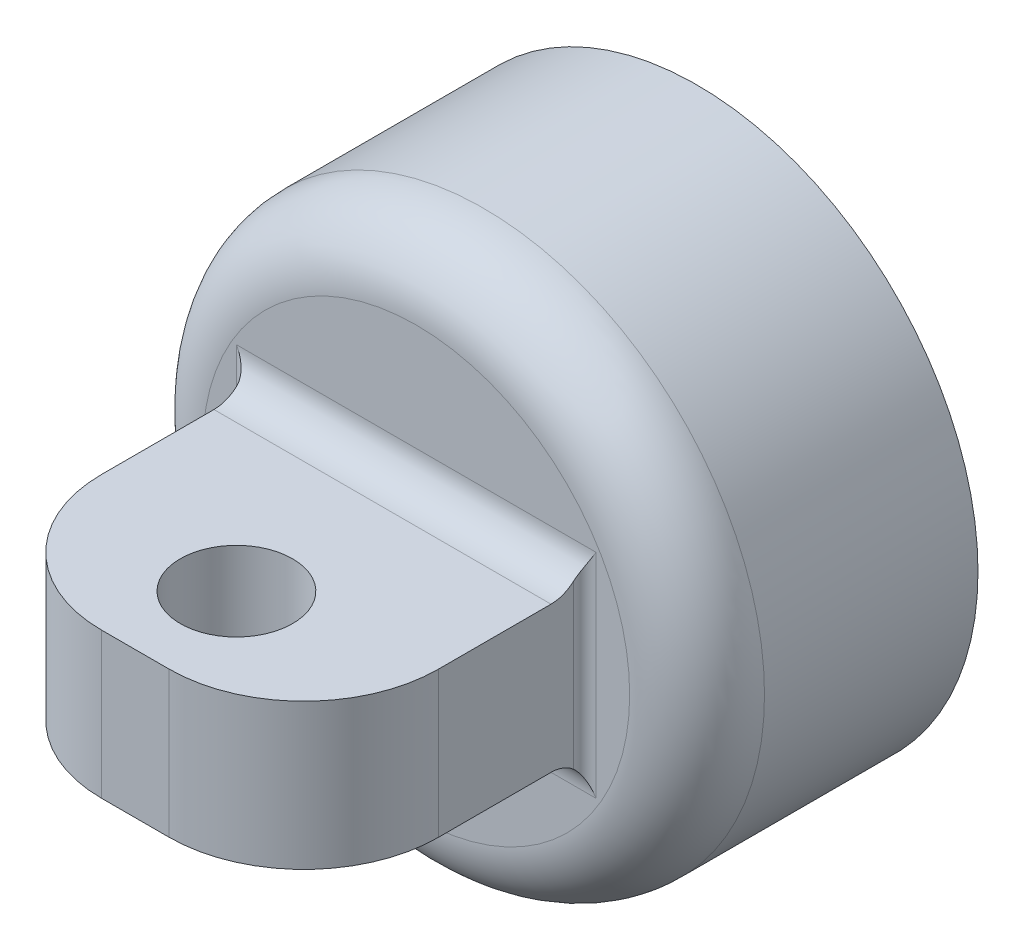
from build123d import *

# Parameters (mm, degrees)
SKETCH1_R           = 25
BOSS_EXTRUDE1_DEPTH = 25
SKETCH2_W           = 30
SKETCH2_H           = 12.964212382
BOSS_EXTRUDE2_DEPTH = 25
FILLET1_R           = 12
FILLET2_R           = 1
FILLET3_R           = 3
SKETCH3_R           = 5
CUT_EXTRUDE1_DEPTH  = 12.964212381
FILLET4_R           = 6


with BuildPart() as part:
    # Sketch1 → Boss-Extrude1 (new body)
    with BuildSketch(Plane.XY):
        Circle(SKETCH1_R)
    extrude(amount=BOSS_EXTRUDE1_DEPTH)

    # Sketch2 → Boss-Extrude2 (add)
    with BuildSketch(Plane.XY.offset(25)):
        Rectangle(SKETCH2_W, SKETCH2_H)
    extrude(amount=BOSS_EXTRUDE2_DEPTH)

    # Fillet1
    fillet1_edges = [part.edges().sort_by_distance(p)[0] for p in [
        (15, 0, 50),
        (-15, 0, 50),
    ]]
    fillet(fillet1_edges, radius=FILLET1_R)

    # Fillet2
    fillet2_edges = [part.edges().sort_by_distance(p)[0] for p in [
        (15, 0, 25),
        (-15, 0, 25),
    ]]
    fillet(fillet2_edges, radius=FILLET2_R)

    # Fillet3
    fillet3_edges = [part.edges().sort_by_distance(p)[0] for p in [
        (0, -6.482106191, 25),
    ]]
    fillet(fillet3_edges, radius=FILLET3_R)
    fillet3_2_edges = [part.edges().sort_by_distance(p)[0] for p in [
        (0, 6.482106191, 25),
    ]]
    fillet(fillet3_2_edges, radius=FILLET3_R)

    # Sketch3 → Cut-Extrude1 (cut)
    with BuildSketch(Plane.XZ.offset(6.482106191)):
        with Locations(Location((0, 41, 0), (0, 0, 270))):
            Circle(SKETCH3_R)
    extrude(amount=-CUT_EXTRUDE1_DEPTH, mode=Mode.SUBTRACT)

    # Fillet4
    fillet4_edges = [part.edges().sort_by_distance(p)[0] for p in [
        (-25, 0, 25),
    ]]
    fillet(fillet4_edges, radius=FILLET4_R)


solid = part.part
